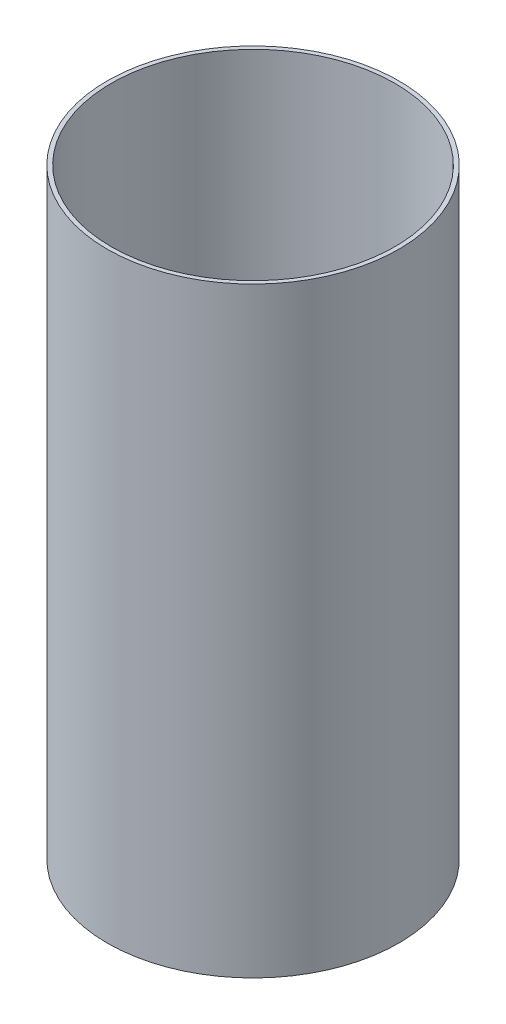
from build123d import *

# Parameters (mm, degrees)
SKETCH1_R           = 76.2
SKETCH1_R_2         = 74.04
BOSS_EXTRUDE1_DEPTH = 314


with BuildPart() as part:
    # Sketch1 → Boss-Extrude1 (new body)
    with BuildSketch(Plane(origin=(0, 0, 0), x_dir=(1, 0, 0), z_dir=(0, 1, 0))):
        Circle(SKETCH1_R)
        Circle(SKETCH1_R_2, mode=Mode.SUBTRACT)
    extrude(amount=BOSS_EXTRUDE1_DEPTH)


solid = part.part
